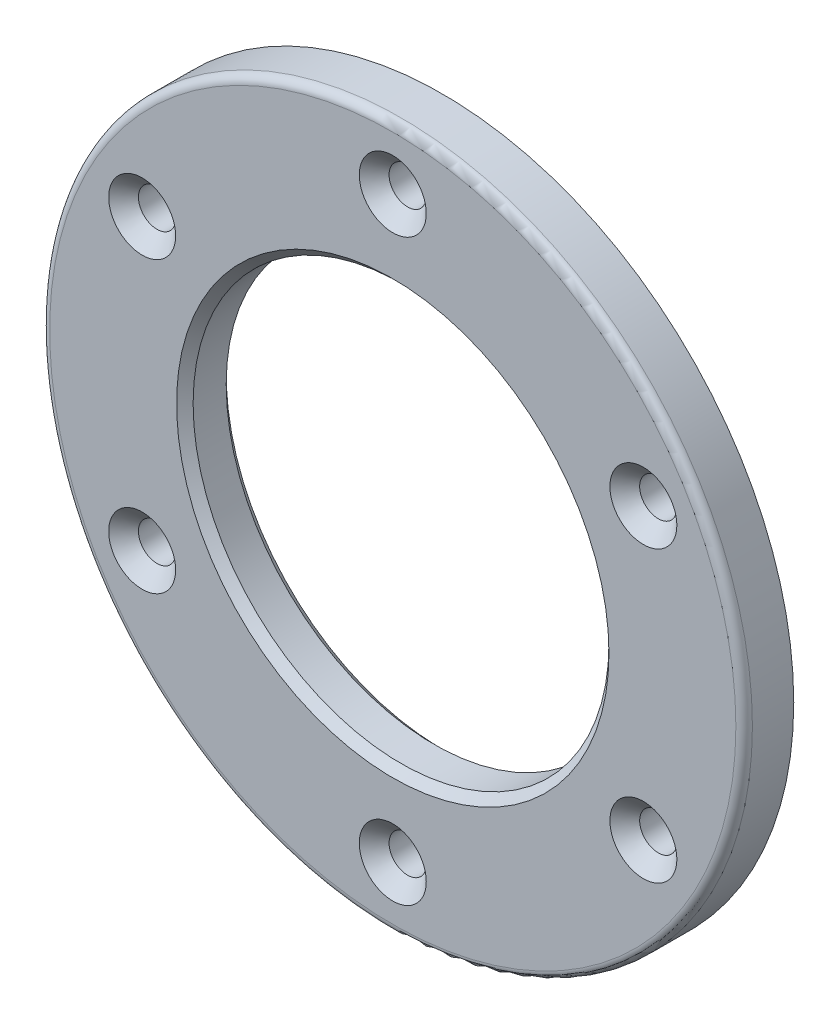
from build123d import *

# Parameters (mm, degrees)
SKETCH1_R                    = 42.5
BOSS_EXTRUDE1_DEPTH          = 6
SKETCH2_R                    = 25.15
CUT_EXTRUDE1_DEPTH           = 61.402814504
SKETCH3_R                    = 2.25
CUT_EXTRUDE2_DEPTH           = 61.402814504
CHAMFER2_SIZE                = 1.8
CIRPATTERN1_COUNT            = 6
CHAMFER2_OF_CIRPATTERN1_SIZE = 1.8
CHAMFER1_SIZE                = 1
FILLET1_R                    = 1


with BuildPart() as part:
    # Sketch1 → Boss-Extrude1 (new body)
    with BuildSketch(Plane.XY):
        Circle(SKETCH1_R)
    extrude(amount=BOSS_EXTRUDE1_DEPTH)

    # Sketch2 → Cut-Extrude1 (cut, through all)
    with BuildSketch(Plane.XY.offset(6)):
        Circle(SKETCH2_R)
    extrude(amount=-CUT_EXTRUDE1_DEPTH, mode=Mode.SUBTRACT)

    # Sketch3 → Cut-Extrude2 (cut, through all)
    with BuildSketch(Plane.XY.offset(6)):
        with Locations((0, 35)):
            Circle(SKETCH3_R)
    cut_extrude2 = extrude(amount=-CUT_EXTRUDE2_DEPTH, mode=Mode.SUBTRACT)

    # Chamfer2
    chamfer2_edges = [part.edges().sort_by_distance(p)[0] for p in [
        (-2.25, 35, 6),
    ]]
    chamfer(chamfer2_edges, length=CHAMFER2_SIZE)

    # CirPattern1: Cut-Extrude2 ×6 about axis
    cirpattern1_axis = Axis((0, 0, 6), (0, 0, -1))
    for i in range(1, CIRPATTERN1_COUNT):
        add(cut_extrude2.rotate(cirpattern1_axis, i * 360 / CIRPATTERN1_COUNT), mode=Mode.SUBTRACT)

    # Chamfer2 of CirPattern1
    chamfer2_of_cirpattern1_edges = [part.edges().sort_by_distance(p)[0] for p in [
        (29.185889132, 19.448557159, 6),
        (31.435889132, -15.551442841, 6),
        (2.25, -35, 6),
        (-29.185889132, -19.448557159, 6),
        (-31.435889132, 15.551442841, 6),
    ]]
    chamfer(chamfer2_of_cirpattern1_edges, length=CHAMFER2_OF_CIRPATTERN1_SIZE)

    # Chamfer1
    chamfer1_edges = [part.edges().sort_by_distance(p)[0] for p in [
        (-25.15, 0, 0),
        (-25.15, 0, 6),
    ]]
    chamfer(chamfer1_edges, length=CHAMFER1_SIZE)

    # Fillet1
    fillet1_edges = [part.edges().sort_by_distance(p)[0] for p in [
        (-42.5, 0, 6),
    ]]
    fillet(fillet1_edges, radius=FILLET1_R)


solid = part.part
